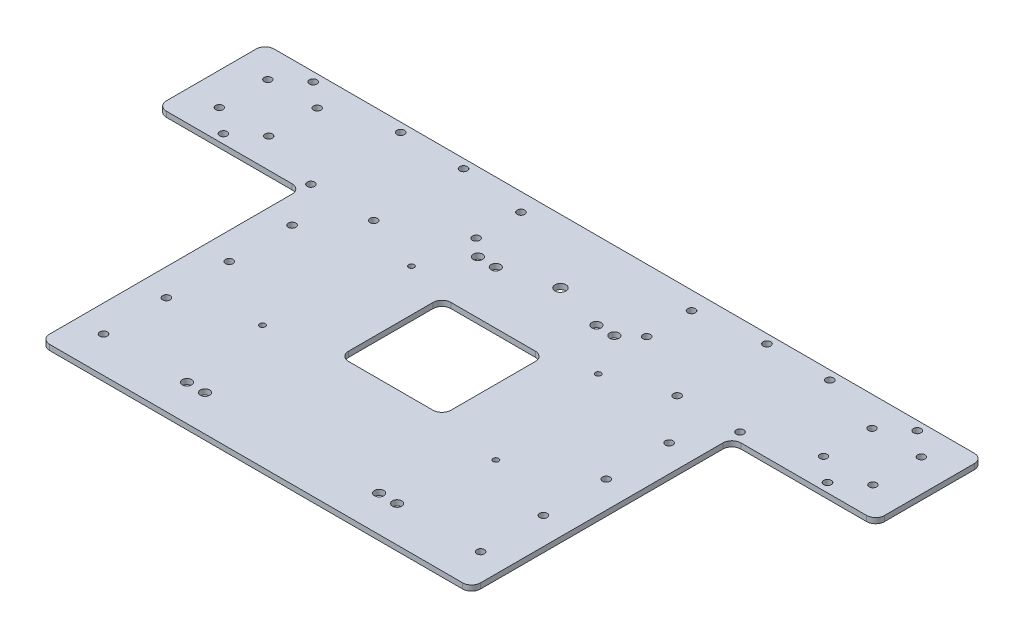
from build123d import *

# Parameters (mm, degrees)
SKETCH_1_R          = 2.1
SKETCH_1_R_2        = 3.05
SKETCH_1_W          = 57
SKETCH_1_H          = 57
EXTRUDE_1365_DEPTH  = 3
SKETCH_2_R          = 2.05
SKETCH_2_R_2        = 2.1
CUT_EXTRUDE_1_DEPTH = 285.15708598
FILLET_1_R          = 5
SKETCH_3_R          = 2.1
SKETCH_3_R_2        = 1.55
SKETCH_3_R_3        = 2.6
CUT_EXTRUDE_2_DEPTH = 285.15708598


with BuildPart() as part:
    # 草图1 → Extrude 1365 (new body)
    with BuildSketch(Plane(origin=(0, 0, 0), x_dir=(1, 0, 0), z_dir=(0, 1, 0))):
        Polygon((-164.424075228, 46.128249268), (-164.424075228, -13.871750732), (-84.424075228, -13.871750732), (-84.424075228, -158.871750732), (155.575924772, -158.871750732), (155.575924772, -13.871750732), (235.575924772, -13.871750732), (235.575924772, 46.128249268), align=None)
        with Locations((-11.924075228, 11.128249268)):
            Circle(SKETCH_1_R, mode=Mode.SUBTRACT)
        with Locations((-11.924075228, 36.128249268)):
            Circle(SKETCH_1_R, mode=Mode.SUBTRACT)
        with Locations((35.575924772, 10.628249268)):
            Circle(SKETCH_1_R_2, mode=Mode.SUBTRACT)
        with Locations((83.075924772, 11.128249268)):
            Circle(SKETCH_1_R, mode=Mode.SUBTRACT)
        with Locations((83.075924772, 36.128249268)):
            Circle(SKETCH_1_R, mode=Mode.SUBTRACT)
        with Locations((35.575924772, -55.371750732)):
            Rectangle(SKETCH_1_W, SKETCH_1_H, mode=Mode.SUBTRACT)
    extrude(amount=EXTRUDE_1365_DEPTH)

    # 草图2 → 切除-拉伸1 (cut, through all)
    with BuildSketch(Plane(origin=(0, 3, 0), x_dir=(1, 0, 0), z_dir=(0, 1, 0))):
        with Locations((-146.424075228, 29.628249268)):
            Circle(SKETCH_2_R)
        with Locations((-146.424075228, 2.628249268)):
            Circle(SKETCH_2_R)
        with Locations((-118.924075228, 29.628249268)):
            Circle(SKETCH_2_R)
        with Locations((-118.924075228, 2.628249268)):
            Circle(SKETCH_2_R)
        with Locations((-48.924075228, 41.128249268)):
            Circle(SKETCH_2_R_2)
        with Locations((-83.924075228, 41.128249268)):
            Circle(SKETCH_2_R_2)
        with Locations((-48.924075228, -8.871750732)):
            Circle(SKETCH_2_R_2)
        with Locations((-83.924075228, -8.871750732)):
            Circle(SKETCH_2_R_2)
        with Locations((-132.674075228, 41.128249268)):
            Circle(SKETCH_2_R_2)
        with Locations((-132.674075228, -8.871750732)):
            Circle(SKETCH_2_R_2)
        with Locations((203.825924772, -8.871750732)):
            Circle(SKETCH_2_R_2)
        with Locations((203.825924772, 41.128249268)):
            Circle(SKETCH_2_R_2)
        with Locations((155.075924772, -8.871750732)):
            Circle(SKETCH_2_R_2)
        with Locations((120.075924772, -8.871750732)):
            Circle(SKETCH_2_R_2)
        with Locations((155.075924772, 41.128249268)):
            Circle(SKETCH_2_R_2)
        with Locations((120.075924772, 41.128249268)):
            Circle(SKETCH_2_R_2)
        with Locations((190.075924772, 2.628249268)):
            Circle(SKETCH_2_R)
        with Locations((190.075924772, 29.628249268)):
            Circle(SKETCH_2_R)
        with Locations((217.575924772, 2.628249268)):
            Circle(SKETCH_2_R)
        with Locations((217.575924772, 29.628249268)):
            Circle(SKETCH_2_R)
    extrude(amount=-CUT_EXTRUDE_1_DEPTH, mode=Mode.SUBTRACT)

    # 圆角1
    fillet_1_edges = [part.edges().sort_by_distance(p)[0] for p in [
        (155.575924772, 1.5, 13.871750732),
        (-84.424075228, 1.5, 13.871750732),
        (235.575924772, 1.5, -46.128249268),
        (235.575924772, 1.5, 13.871750732),
        (155.575924772, 1.5, 158.871750732),
        (-84.424075228, 1.5, 158.871750732),
        (-164.424075228, 1.5, -46.128249268),
        (-164.424075228, 1.5, 13.871750732),
        (7.075924772, 1.5, 83.871750732),
        (64.075924772, 1.5, 83.871750732),
        (64.075924772, 1.5, 26.871750732),
        (7.075924772, 1.5, 26.871750732),
    ]]
    fillet(fillet_1_edges, radius=FILLET_1_R)

    # 草图3 → 切除-拉伸2 (cut, through all)
    with BuildSketch(Plane(origin=(0, 3, 0), x_dir=(1, 0, 0), z_dir=(0, 1, 0))):
        with Locations((-69.424075228, -33.871750732)):
            Circle(SKETCH_3_R)
        with Locations((-69.424075228, -68.871750732)):
            Circle(SKETCH_3_R)
        with Locations((-69.424075228, -103.871750732)):
            Circle(SKETCH_3_R)
        with Locations((-69.424075228, -138.871750732)):
            Circle(SKETCH_3_R)
        with Locations((140.575924772, -138.871750732)):
            Circle(SKETCH_3_R)
        with Locations((140.575924772, -103.871750732)):
            Circle(SKETCH_3_R)
        with Locations((140.575924772, -68.871750732)):
            Circle(SKETCH_3_R)
        with Locations((140.575924772, -33.871750732)):
            Circle(SKETCH_3_R)
        with Locations((-16.424075228, -20.371750732)):
            Circle(SKETCH_3_R_2)
        with Locations((-29.424075228, -90.371750732)):
            Circle(SKETCH_3_R_2)
        with Locations((100.575924772, -90.371750732)):
            Circle(SKETCH_3_R_2)
        with Locations((87.575924772, -20.371750732)):
            Circle(SKETCH_3_R_2)
        with Locations((-2.424075228, 2.628249268)):
            Circle(SKETCH_3_R_3)
        with Locations((7.575924772, 2.628249268)):
            Circle(SKETCH_3_R_3)
        with Locations((63.575924772, 2.628249268)):
            Circle(SKETCH_3_R_3)
        with Locations((73.575924772, 2.628249268)):
            Circle(SKETCH_3_R_3)
        with Locations((-22.924075228, -138.871750732)):
            Circle(SKETCH_3_R_3)
        with Locations((-12.924075228, -138.871750732)):
            Circle(SKETCH_3_R_3)
        with Locations((84.075924772, -138.871750732)):
            Circle(SKETCH_3_R_3)
        with Locations((94.075924772, -138.871750732)):
            Circle(SKETCH_3_R_3)
    extrude(amount=-CUT_EXTRUDE_2_DEPTH, mode=Mode.SUBTRACT)


solid = part.part
